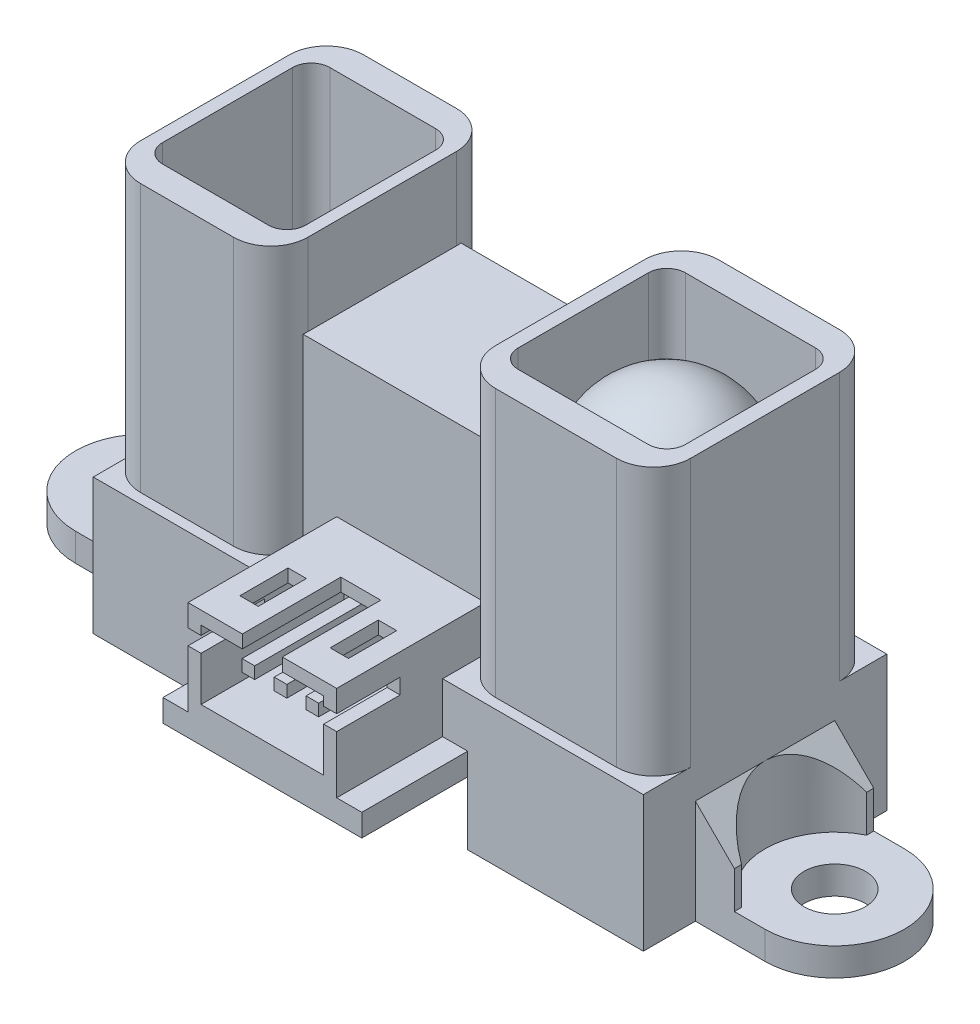
from build123d import *

# Parameters (mm, degrees)
SKETCH_1_W           = 29.6
SKETCH_1_H           = 13.1
EXTRUDE_1_DEPTH      = 7.3
SKETCH_2_W           = 10.5
SKETCH_2_H           = 12
SKETCH_2_W_2         = 9
EXTRUDE_2_DEPTH      = 14.4
SKETCH_3_W           = 10.1
SKETCH_3_H           = 8.5
EXTRUDE_3_DEPTH      = 10
FILLET_1_R           = 2
SKETCH_4_W           = 9
SKETCH_4_H           = 9
SKETCH_4_W_2         = 7.7
CUT_EXTRUDE_2_DEPTH  = 10
EXTRUDE_4_DEPTH      = 5.6
CUT_EXTRUDE_3_DEPTH  = 12.6
SKETCH_8_R           = 3.75
CUT_EXTRUDE_4_DEPTH  = 7.6
SKETCH_9_R           = 1.65
CUT_EXTRUDE_5_DEPTH  = 7.6
CUT_EXTRUDE_6_DEPTH  = 3.4
SKETCH_11_W          = 10.7
SKETCH_11_H          = 1.2
EXTRUDE_5_DEPTH      = 5.7
EXTRUDE_6_REACH      = 38.354
SKETCH_12_W          = 8
SKETCH_12_H          = 5.1
SKETCH_13_W          = 6.6
SKETCH_13_H          = 3.7
CUT_EXTRUDE_7_DEPTH  = 7.7
SKETCH_14_W          = 3.413404973
SKETCH_14_H          = 0.831634307
CUT_EXTRUDE_8_DEPTH  = 9.7
SKETCH_15_W          = 0.989303902
SKETCH_15_H          = 2.593580499
SKETCH_15_W_2        = 2.149434462
SKETCH_15_H_2        = 5.296205569
CUT_EXTRUDE_9_DEPTH  = 2.7
SKETCH_16_W          = 0.67786387
SKETCH_16_H          = 0.642186824
SKETCH_16_W_2        = 0.677863869
SKETCH_16_H_2        = 0.642186825
EXTRUDE_7_DEPTH      = 6.7
SKETCH_17_R          = 4.45
EXTRUDE_8_DEPTH      = 9
FILLET_3_R           = 4.45
FILLET_4_R           = 1
SKETCH_18_W          = 7.7
SKETCH_18_H          = 9
CUT_EXTRUDE_10_DEPTH = 2
SKETCH_19_R          = 3.5
EXTRUDE_9_DEPTH      = 7
FILLET_6_R           = 3.5
FILLET_7_R           = 1


with BuildPart() as part:
    # 草图1 → 凸台-拉伸1 (new body)
    with BuildSketch(Plane(origin=(0, 0, 0), x_dir=(1, 0, 0), z_dir=(0, 1, 0))):
        Rectangle(SKETCH_1_W, SKETCH_1_H)
    extrude(amount=EXTRUDE_1_DEPTH)

    # 草图2 → 凸台-拉伸2 (add)
    with BuildSketch(Plane(origin=(0, 7.3, 0), x_dir=(1, 0, 0), z_dir=(0, 1, 0))):
        with Locations((9.55, 0)):
            Rectangle(SKETCH_2_W, SKETCH_2_H)
        with Locations((-10.3, 0)):
            Rectangle(SKETCH_2_W_2, SKETCH_2_H)
    extrude(amount=EXTRUDE_2_DEPTH)

    # 草图3 → 凸台-拉伸3 (add)
    with BuildSketch(Plane(origin=(0, 7.3, 0), x_dir=(1, 0, 0), z_dir=(0, 1, 0))):
        with Locations((-0.75, 0)):
            Rectangle(SKETCH_3_W, SKETCH_3_H)
    extrude(amount=EXTRUDE_3_DEPTH)

    # 圆角1
    # the kernel refuses this fillet: 2 mm, written as the material it takes off along each edge
    with BuildSketch(Plane(origin=(14.8, 7.3, 6), x_dir=(0, 0, -1), z_dir=(0, 1, 0)), Plane(origin=(-14.8, 7.3, -6), x_dir=(0, 0, 1), z_dir=(0, 1, 0))) as fillet_1_piece_1:
        with BuildLine():
            CenterArc((FILLET_1_R, FILLET_1_R), FILLET_1_R, 180, 90)
            Line((0, FILLET_1_R), (0, 0))
            Line((0, 0), (FILLET_1_R, 0))
        make_face()
    extrude(amount=19.4, mode=Mode.SUBTRACT)
    with BuildSketch(Plane(origin=(4.3, 7.3, 6), x_dir=(1, 0, 0), z_dir=(0, 1, 0))) as fillet_1_piece_2_section:
        with BuildLine():
            CenterArc((FILLET_1_R, FILLET_1_R), FILLET_1_R, 180, 90)
            Line((0, FILLET_1_R), (0, 0))
            Line((0, 0), (FILLET_1_R, 0))
        make_face()
    fillet_1_piece_2 = extrude(amount=19.4, mode=Mode.PRIVATE)
    fillet_1_piece_2 = split(fillet_1_piece_2, bisect_by=Plane(origin=(4.75805712, 12.3, 4.25), z_dir=(0, 0, 1)), keep=Keep.TOP, mode=Mode.PRIVATE)
    fillet_1_piece_2 = split(fillet_1_piece_2, bisect_by=Plane(origin=(4.75805712, 17.3, 5.563068428), z_dir=(0, -1, 0)), keep=Keep.TOP, mode=Mode.PRIVATE)
    add(fillet_1_piece_2, mode=Mode.SUBTRACT)
    with BuildSketch(Plane(origin=(4.3, 7.3, 6), x_dir=(1, 0, 0), z_dir=(0, 1, 0))) as fillet_1_piece_3_section:
        with BuildLine():
            CenterArc((FILLET_1_R, FILLET_1_R), FILLET_1_R, 180, 90)
            Line((0, FILLET_1_R), (0, 0))
            Line((0, 0), (FILLET_1_R, 0))
        make_face()
    fillet_1_piece_3 = extrude(amount=19.4, mode=Mode.PRIVATE)
    fillet_1_piece_3 = split(fillet_1_piece_3, bisect_by=Plane(origin=(4.75805712, 22, 4.25), z_dir=(0, 0, 1)), keep=Keep.TOP, mode=Mode.PRIVATE)
    fillet_1_piece_3 = split(fillet_1_piece_3, bisect_by=Plane(origin=(4.75805712, 17.3, 5.563068428), z_dir=(0, 1, 0)), keep=Keep.TOP, mode=Mode.PRIVATE)
    add(fillet_1_piece_3, mode=Mode.SUBTRACT)
    with BuildSketch(Plane(origin=(4.3, 7.3, 6), x_dir=(1, 0, 0), z_dir=(0, 1, 0))) as fillet_1_piece_4_section:
        with BuildLine():
            CenterArc((FILLET_1_R, FILLET_1_R), FILLET_1_R, 180, 90)
            Line((0, FILLET_1_R), (0, 0))
            Line((0, 0), (FILLET_1_R, 0))
        make_face()
    fillet_1_piece_4 = extrude(amount=19.4, mode=Mode.PRIVATE)
    fillet_1_piece_4 = split(fillet_1_piece_4, bisect_by=Plane(origin=(4.282851875, 22, 4.25), z_dir=(0, 0, -1)), keep=Keep.TOP, mode=Mode.PRIVATE)
    fillet_1_piece_4 = split(fillet_1_piece_4, bisect_by=Plane(origin=(4.282851875, 17.3, 4.132221144), z_dir=(0, 1, 0)), keep=Keep.TOP, mode=Mode.PRIVATE)
    add(fillet_1_piece_4, mode=Mode.SUBTRACT)
    with BuildSketch(Plane(origin=(14.8, 7.3, -6), x_dir=(0, 0, 1), z_dir=(0, 1, 0)), Plane(origin=(-14.8, 7.3, 6), x_dir=(0, 0, -1), z_dir=(0, 1, 0))) as fillet_1_piece_5:
        with BuildLine():
            CenterArc((FILLET_1_R, -FILLET_1_R), FILLET_1_R, 90, 90)
            Line((0, -FILLET_1_R), (0, 0))
            Line((0, 0), (FILLET_1_R, 0))
        make_face()
    extrude(amount=19.4, mode=Mode.SUBTRACT)
    with BuildSketch(Plane(origin=(4.3, 7.3, -6), x_dir=(1, 0, 0), z_dir=(0, 1, 0))) as fillet_1_piece_6_section:
        with BuildLine():
            CenterArc((FILLET_1_R, -FILLET_1_R), FILLET_1_R, 90, 90)
            Line((0, -FILLET_1_R), (0, 0))
            Line((0, 0), (FILLET_1_R, 0))
        make_face()
    fillet_1_piece_6 = extrude(amount=19.4, mode=Mode.PRIVATE)
    fillet_1_piece_6 = split(fillet_1_piece_6, bisect_by=Plane(origin=(4.75805712, 12.3, -4.25), z_dir=(0, 0, -1)), keep=Keep.TOP, mode=Mode.PRIVATE)
    fillet_1_piece_6 = split(fillet_1_piece_6, bisect_by=Plane(origin=(4.75805712, 17.3, -5.563068428), z_dir=(0, -1, 0)), keep=Keep.TOP, mode=Mode.PRIVATE)
    add(fillet_1_piece_6, mode=Mode.SUBTRACT)
    with BuildSketch(Plane(origin=(4.3, 7.3, -6), x_dir=(1, 0, 0), z_dir=(0, 1, 0))) as fillet_1_piece_7_section:
        with BuildLine():
            CenterArc((FILLET_1_R, -FILLET_1_R), FILLET_1_R, 90, 90)
            Line((0, -FILLET_1_R), (0, 0))
            Line((0, 0), (FILLET_1_R, 0))
        make_face()
    fillet_1_piece_7 = extrude(amount=19.4, mode=Mode.PRIVATE)
    fillet_1_piece_7 = split(fillet_1_piece_7, bisect_by=Plane(origin=(4.75805712, 22, -4.25), z_dir=(0, 0, -1)), keep=Keep.TOP, mode=Mode.PRIVATE)
    fillet_1_piece_7 = split(fillet_1_piece_7, bisect_by=Plane(origin=(4.75805712, 17.3, -5.563068428), z_dir=(0, 1, 0)), keep=Keep.TOP, mode=Mode.PRIVATE)
    add(fillet_1_piece_7, mode=Mode.SUBTRACT)
    with BuildSketch(Plane(origin=(4.3, 7.3, -6), x_dir=(1, 0, 0), z_dir=(0, 1, 0))) as fillet_1_piece_8_section:
        with BuildLine():
            CenterArc((FILLET_1_R, -FILLET_1_R), FILLET_1_R, 90, 90)
            Line((0, -FILLET_1_R), (0, 0))
            Line((0, 0), (FILLET_1_R, 0))
        make_face()
    fillet_1_piece_8 = extrude(amount=19.4, mode=Mode.PRIVATE)
    fillet_1_piece_8 = split(fillet_1_piece_8, bisect_by=Plane(origin=(4.282851875, 22, -4.25), z_dir=(0, 0, 1)), keep=Keep.TOP, mode=Mode.PRIVATE)
    fillet_1_piece_8 = split(fillet_1_piece_8, bisect_by=Plane(origin=(4.282851875, 17.3, -4.132221144), z_dir=(0, 1, 0)), keep=Keep.TOP, mode=Mode.PRIVATE)
    add(fillet_1_piece_8, mode=Mode.SUBTRACT)
    with BuildSketch(Plane(origin=(-5.8, 7.3, -6), x_dir=(-1, 0, 0), z_dir=(0, 1, 0))) as fillet_1_piece_9_section:
        with BuildLine():
            CenterArc((FILLET_1_R, FILLET_1_R), FILLET_1_R, 180, 90)
            Line((0, FILLET_1_R), (0, 0))
            Line((0, 0), (FILLET_1_R, 0))
        make_face()
    fillet_1_piece_9 = extrude(amount=19.4, mode=Mode.PRIVATE)
    fillet_1_piece_9 = split(fillet_1_piece_9, bisect_by=Plane(origin=(-6.25805712, 12.3, -4.25), z_dir=(0, 0, -1)), keep=Keep.TOP, mode=Mode.PRIVATE)
    fillet_1_piece_9 = split(fillet_1_piece_9, bisect_by=Plane(origin=(-6.25805712, 17.3, -5.563068428), z_dir=(0, -1, 0)), keep=Keep.TOP, mode=Mode.PRIVATE)
    add(fillet_1_piece_9, mode=Mode.SUBTRACT)
    with BuildSketch(Plane(origin=(-5.8, 7.3, -6), x_dir=(-1, 0, 0), z_dir=(0, 1, 0))) as fillet_1_piece_10_section:
        with BuildLine():
            CenterArc((FILLET_1_R, FILLET_1_R), FILLET_1_R, 180, 90)
            Line((0, FILLET_1_R), (0, 0))
            Line((0, 0), (FILLET_1_R, 0))
        make_face()
    fillet_1_piece_10 = extrude(amount=19.4, mode=Mode.PRIVATE)
    fillet_1_piece_10 = split(fillet_1_piece_10, bisect_by=Plane(origin=(-6.25805712, 22, -4.25), z_dir=(0, 0, -1)), keep=Keep.TOP, mode=Mode.PRIVATE)
    fillet_1_piece_10 = split(fillet_1_piece_10, bisect_by=Plane(origin=(-6.25805712, 17.3, -5.563068428), z_dir=(0, 1, 0)), keep=Keep.TOP, mode=Mode.PRIVATE)
    add(fillet_1_piece_10, mode=Mode.SUBTRACT)
    with BuildSketch(Plane(origin=(-5.8, 7.3, -6), x_dir=(-1, 0, 0), z_dir=(0, 1, 0))) as fillet_1_piece_11_section:
        with BuildLine():
            CenterArc((FILLET_1_R, FILLET_1_R), FILLET_1_R, 180, 90)
            Line((0, FILLET_1_R), (0, 0))
            Line((0, 0), (FILLET_1_R, 0))
        make_face()
    fillet_1_piece_11 = extrude(amount=19.4, mode=Mode.PRIVATE)
    fillet_1_piece_11 = split(fillet_1_piece_11, bisect_by=Plane(origin=(-5.782851875, 22, -4.25), z_dir=(0, 0, 1)), keep=Keep.TOP, mode=Mode.PRIVATE)
    fillet_1_piece_11 = split(fillet_1_piece_11, bisect_by=Plane(origin=(-5.782851875, 17.3, -4.132221144), z_dir=(0, 1, 0)), keep=Keep.TOP, mode=Mode.PRIVATE)
    add(fillet_1_piece_11, mode=Mode.SUBTRACT)
    with BuildSketch(Plane(origin=(-5.8, 7.3, 6), x_dir=(-1, 0, 0), z_dir=(0, 1, 0))) as fillet_1_piece_12_section:
        with BuildLine():
            CenterArc((FILLET_1_R, -FILLET_1_R), FILLET_1_R, 90, 90)
            Line((0, -FILLET_1_R), (0, 0))
            Line((0, 0), (FILLET_1_R, 0))
        make_face()
    fillet_1_piece_12 = extrude(amount=19.4, mode=Mode.PRIVATE)
    fillet_1_piece_12 = split(fillet_1_piece_12, bisect_by=Plane(origin=(-6.25805712, 17.3, 5.563068428), z_dir=(0, -1, 0)), keep=Keep.TOP, mode=Mode.PRIVATE)
    fillet_1_piece_12 = split(fillet_1_piece_12, bisect_by=Plane(origin=(-6.25805712, 12.3, 4.25), z_dir=(0, 0, 1)), keep=Keep.TOP, mode=Mode.PRIVATE)
    add(fillet_1_piece_12, mode=Mode.SUBTRACT)
    with BuildSketch(Plane(origin=(-5.8, 7.3, 6), x_dir=(-1, 0, 0), z_dir=(0, 1, 0))) as fillet_1_piece_13_section:
        with BuildLine():
            CenterArc((FILLET_1_R, -FILLET_1_R), FILLET_1_R, 90, 90)
            Line((0, -FILLET_1_R), (0, 0))
            Line((0, 0), (FILLET_1_R, 0))
        make_face()
    fillet_1_piece_13 = extrude(amount=19.4, mode=Mode.PRIVATE)
    fillet_1_piece_13 = split(fillet_1_piece_13, bisect_by=Plane(origin=(-6.25805712, 17.3, 5.563068428), z_dir=(0, 1, 0)), keep=Keep.TOP, mode=Mode.PRIVATE)
    fillet_1_piece_13 = split(fillet_1_piece_13, bisect_by=Plane(origin=(-6.25805712, 22, 4.25), z_dir=(0, 0, 1)), keep=Keep.TOP, mode=Mode.PRIVATE)
    add(fillet_1_piece_13, mode=Mode.SUBTRACT)
    with BuildSketch(Plane(origin=(-5.8, 7.3, 6), x_dir=(-1, 0, 0), z_dir=(0, 1, 0))) as fillet_1_piece_14_section:
        with BuildLine():
            CenterArc((FILLET_1_R, -FILLET_1_R), FILLET_1_R, 90, 90)
            Line((0, -FILLET_1_R), (0, 0))
            Line((0, 0), (FILLET_1_R, 0))
        make_face()
    fillet_1_piece_14 = extrude(amount=19.4, mode=Mode.PRIVATE)
    fillet_1_piece_14 = split(fillet_1_piece_14, bisect_by=Plane(origin=(-5.782851875, 17.3, 4.132221144), z_dir=(0, 1, 0)), keep=Keep.TOP, mode=Mode.PRIVATE)
    fillet_1_piece_14 = split(fillet_1_piece_14, bisect_by=Plane(origin=(-5.782851875, 22, 4.25), z_dir=(0, 0, -1)), keep=Keep.TOP, mode=Mode.PRIVATE)
    add(fillet_1_piece_14, mode=Mode.SUBTRACT)

    # 草图4 → 切除-拉伸2 (cut)
    with BuildSketch(Plane(origin=(0, 21.7, 0), x_dir=(1, 0, 0), z_dir=(0, 1, 0))):
        with Locations((9.516278165, 0)):
            Rectangle(SKETCH_4_W, SKETCH_4_H)
        with Locations((-10.271744936, 0)):
            Rectangle(SKETCH_4_W_2, SKETCH_4_H)
    extrude(amount=-CUT_EXTRUDE_2_DEPTH, mode=Mode.SUBTRACT)

    # 草图5 → 凸台-拉伸4 (add)
    with BuildSketch(Plane.XZ):
        with BuildLine():
            Line((-18.55, 3.75), (18.55, 3.75))
            ThreePointArc((18.55, 3.75), (22.3, 0), (18.55, -3.75))
            Line((18.55, -3.75), (-18.55, -3.75))
            ThreePointArc((-18.55, -3.75), (-22.3, 0), (-18.55, 3.75))
        make_face()
    extrude(amount=-EXTRUDE_4_DEPTH)

    # 草图6 → 切除-拉伸3 (cut)
    with BuildSketch(Plane(origin=(0, 0, -3.75), x_dir=(-1, 0, 0), z_dir=(0, 0, -1))):
        Polygon((-14.8, 5.6), (-16.9, 3.5), (-16.9, 1.5), (-22.3, 1.5), (-22.3, 5.6), align=None)
        Polygon((22.3, 1.5), (22.3, 5.6), (14.8, 5.6), (16.9, 3.5), (16.9, 1.5), align=None)
    extrude(amount=-CUT_EXTRUDE_3_DEPTH, mode=Mode.SUBTRACT)

    # 草图8 → 切除-拉伸4 (cut)
    with BuildSketch(Plane(origin=(0, 1.5, 0), x_dir=(1, 0, 0), z_dir=(0, 1, 0))):
        with Locations((-18.55, 0)):
            Circle(SKETCH_8_R)
        with Locations((18.55, 0)):
            Circle(SKETCH_8_R)
    extrude(amount=CUT_EXTRUDE_4_DEPTH, mode=Mode.SUBTRACT)

    # 草图9 → 切除-拉伸5 (cut)
    with BuildSketch(Plane(origin=(0, 1.5, 0), x_dir=(1, 0, 0), z_dir=(0, 1, 0))):
        with Locations(Location((-18.55, 0, 0), (0, 0, 180))):
            Circle(SKETCH_9_R)
        with Locations(Location((18.55, 0, 0), (0, 0, 180))):
            Circle(SKETCH_9_R)
    extrude(amount=-CUT_EXTRUDE_5_DEPTH, mode=Mode.SUBTRACT)

    # 草图10 → 切除-拉伸6 (cut)
    with BuildSketch(Plane.XZ):
        Polygon((-14, 5.75), (-5.35, 5.75), (-5.35, 6.55), (5.35, 6.55), (5.35, 5.75), (14, 5.75), (14, -5.75), (-14, -5.75), align=None)
    extrude(amount=-CUT_EXTRUDE_6_DEPTH, mode=Mode.SUBTRACT)

    # 草图11 → 凸台-拉伸5 (add)
    with BuildSketch(Plane.XY.offset(6.55)):
        with Locations((0, 4)):
            Rectangle(SKETCH_11_W, SKETCH_11_H)
    extrude(amount=EXTRUDE_5_DEPTH)

    # 凸台-拉伸6: up to this face of the body (flat: up to its plane)
    extrude_6_end = Plane(part.part.faces().sort_by_distance((-0.75, 12.3, 4.25))[0])
    # 草图12 → 凸台-拉伸6 (add, up to the picked face)
    with BuildSketch(Plane.XY.offset(12.25), mode=Mode.PRIVATE) as extrude_6_sk1:
        with Locations((0, 7.15)):
            Rectangle(SKETCH_12_W, SKETCH_12_H)
    extrude_6_tool1 = split(extrude(extrude_6_sk1.sketch, amount=-EXTRUDE_6_REACH, mode=Mode.PRIVATE), bisect_by=extrude_6_end, keep=Keep.BOTH, mode=Mode.PRIVATE)
    add(extrude_6_tool1.solids().sort_by(Axis((0, 7.15, 12.25), (0, 0, -1)))[0])

    # 草图13 → 切除-拉伸7 (cut)
    with BuildSketch(Plane.XY.offset(12.25)):
        with Locations((0, 7.15)):
            Rectangle(SKETCH_13_W, SKETCH_13_H)
    extrude(amount=-CUT_EXTRUDE_7_DEPTH, mode=Mode.SUBTRACT)

    # 草图14 → 切除-拉伸8 (cut)
    with BuildSketch(Plane.ZY.offset(4)):
        with Locations((10.543297514, 8.10113554)):
            Rectangle(SKETCH_14_W, SKETCH_14_H)
    extrude(amount=-CUT_EXTRUDE_8_DEPTH, mode=Mode.SUBTRACT)

    # 草图15 → 切除-拉伸9 (cut)
    with BuildSketch(Plane(origin=(0, 9.7, 0), x_dir=(1, 0, 0), z_dir=(0, 1, 0))):
        with Locations((-2.427883841, -9.241170147)):
            Rectangle(SKETCH_15_W, SKETCH_15_H)
        with Locations((0, -9.601897215)):
            Rectangle(SKETCH_15_W_2, SKETCH_15_H_2)
        with Locations((2.427883841, -9.241170147)):
            Rectangle(SKETCH_15_W, SKETCH_15_H)
    extrude(amount=-CUT_EXTRUDE_9_DEPTH, mode=Mode.SUBTRACT)

    # 草图16 → 凸台-拉伸7 (add)
    with BuildSketch(Plane.XY.offset(4.55)):
        with Locations((-1.752126005, 7.223491528)):
            Rectangle(SKETCH_16_W, SKETCH_16_H)
        with Locations((-0.021789285, 7.223491528)):
            Rectangle(SKETCH_16_W, SKETCH_16_H)
        with Locations((1.690708913, 7.205653006)):
            Rectangle(SKETCH_16_W_2, SKETCH_16_H_2)
    extrude(amount=EXTRUDE_7_DEPTH)

    # 草图17 → 凸台-拉伸8 (add)
    with BuildSketch(Plane(origin=(0, 11.7, 0), x_dir=(1, 0, 0), z_dir=(0, 1, 0))):
        with Locations(Location((9.523383973, -0.019035269, 0), (0, 0, 90))):
            Circle(SKETCH_17_R)
    extrude(amount=EXTRUDE_8_DEPTH)

    # 圆角3
    fillet_3_edges = [part.edges().sort_by_distance(p)[0] for p in [
        (9.523383973, 20.7, 4.469035269),
    ]]
    fillet(fillet_3_edges, radius=FILLET_3_R)

    # 圆角4
    fillet_4_edges = [part.edges().sort_by_distance(p)[0] for p in [
        (14.016278165, 16.7, -4.5),
        (14.016278165, 16.7, 4.5),
        (5.016278165, 16.7, 4.5),
        (5.016278165, 16.7, -4.5),
    ]]
    fillet(fillet_4_edges, radius=FILLET_4_R)

    # 草图18 → 切除-拉伸10 (cut)
    with BuildSketch(Plane(origin=(0, 11.7, 0), x_dir=(1, 0, 0), z_dir=(0, 1, 0))):
        with Locations((-10.271744936, 0)):
            Rectangle(SKETCH_18_W, SKETCH_18_H)
    extrude(amount=-CUT_EXTRUDE_10_DEPTH, mode=Mode.SUBTRACT)

    # 草图19 → 凸台-拉伸9 (add)
    with BuildSketch(Plane(origin=(0, 9.7, 0), x_dir=(1, 0, 0), z_dir=(0, 1, 0))):
        with Locations(Location((-10.279996895, 0.03221439, 0), (0, 0, 270))):
            Circle(SKETCH_19_R)
    extrude(amount=EXTRUDE_9_DEPTH)

    # 圆角6
    fillet_6_edges = [part.edges().sort_by_distance(p)[0] for p in [
        (-10.279996895, 16.7, -3.53221439),
    ]]
    fillet(fillet_6_edges, radius=FILLET_6_R)

    # 圆角7
    fillet_7_edges = [part.edges().sort_by_distance(p)[0] for p in [
        (-6.421744936, 15.7, -4.5),
        (-6.421744936, 15.7, 4.5),
        (-14.121744936, 15.7, 4.5),
        (-14.121744936, 15.7, -4.5),
    ]]
    fillet(fillet_7_edges, radius=FILLET_7_R)


solid = part.part
